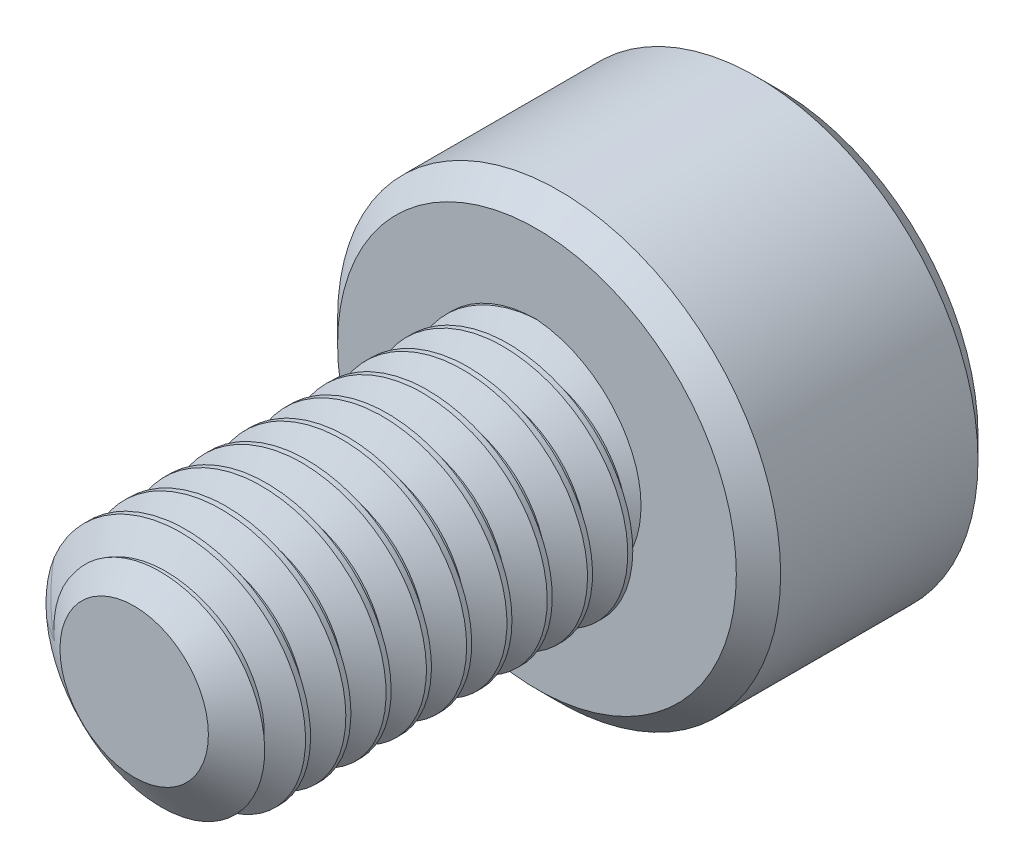
from build123d import *

# Parameters (mm, degrees)
SKETCH1_R          = 1.5
EXTRUDE1_DEPTH     = 5
CUT_SWEEP1_PITCH   = 0.5
SKETCH6_R          = 2.75
EXTRUDE2_DEPTH     = 3
CUT_EXTRUDE1_DEPTH = 1.875
CHAMFER1_SIZE      = 0.275


with BuildPart() as part:
    # Sketch1 → Extrude1 (new body)
    with BuildSketch(Plane.XY):
        Circle(SKETCH1_R)
    extrude(amount=-EXTRUDE1_DEPTH)

    # Cut-Sweep1: the profile of Sketch3 profile screwed along a right-hand helix of 11 turns, 6 arcs to a turn; built about Z, then put on its axis
    cut_sweep1_z = Axis((0, 0, 0), (0, 0, 1))
    cut_sweep1_corners = [(1.5003, 0, -0.437673205), (1.175240474, 0, -0.25), (1.175240474, 0, -0.1875), (1.5003, 0, 0.000173205)]
    with BuildLine(mode=Mode.PRIVATE) as cut_sweep1_profile:
        Line(cut_sweep1_corners[0], cut_sweep1_corners[1])
        Line(cut_sweep1_corners[1], cut_sweep1_corners[2])
        Line(cut_sweep1_corners[2], cut_sweep1_corners[3])
        Line(cut_sweep1_corners[3], cut_sweep1_corners[0])
    cut_sweep1_cap = Face(cut_sweep1_profile.wire())
    cut_sweep1_turn_angles = [0, 30, 60, 90, 120, 150, 180, 210, 240, 270, 300, 330, 360]
    cut_sweep1_turn_weights = [1, 0.8660254037844387, 1, 0.8660254037844387, 1, 0.8660254037844387, 1, 0.8660254037844387, 1, 0.8660254037844387, 1, 0.8660254037844387, 1]
    cut_sweep1_turn_rails = [Edge.make_bspline([Vector(p[0], p[1], 0).rotate(cut_sweep1_z, cut_sweep1_turn_angles[k]) / cut_sweep1_turn_weights[k] + Vector(0, 0, p[2] + CUT_SWEEP1_PITCH * cut_sweep1_turn_angles[k] / 360) for k in range(13)], [0, 0, 0, 1, 1, 2, 2, 3, 3, 4, 4, 5, 5, 6, 6, 6], 2, cut_sweep1_turn_weights) for p in cut_sweep1_corners]
    cut_sweep1_turn_sides = [Face.make_surface_from_curves(cut_sweep1_turn_rails[p[0]], cut_sweep1_turn_rails[p[1]]) for p in [(0, 1), (1, 2), (2, 3), (3, 0)]]
    cut_sweep1 = Plane(origin=(0, 0, 0), x_dir=(0, 1, 0), z_dir=(0, 0, -1)) * Solid(Shell([*[p.moved(Location((0, 0, CUT_SWEEP1_PITCH * i))) for i in range(11) for p in cut_sweep1_turn_sides], cut_sweep1_cap, cut_sweep1_cap.rotate(cut_sweep1_z, 3960).moved(Location((0, 0, CUT_SWEEP1_PITCH * 3960 / 360)))]))
    add(cut_sweep1, mode=Mode.SUBTRACT)

    # Sketch4 → Cut-Revolve1 (revolve, cut)
    with BuildSketch(Plane(origin=(0, 0, 0), x_dir=(0, 0, -1), z_dir=(1, 0, 0)), mode=Mode.PRIVATE) as cut_revolve1_sk:
        Polygon((0.405251783, 1.5), (0, 0.921240474), (0, 1.5), align=None)
    revolve(cut_revolve1_sk.sketch.rotate(Axis((0, 0, 0), (0, 0, -1)), 263.352109169), axis=Axis((0, 0, 0), (0, 0, -1)), mode=Mode.SUBTRACT)

    # Sketch6 → Extrude2 (add)
    with BuildSketch(Plane(origin=(0, 0, -5), x_dir=(-1, 0, 0), z_dir=(0, 0, -1))):
        Circle(SKETCH6_R)
    extrude(amount=EXTRUDE2_DEPTH)

    # Sketch7 → Cut-Extrude1 (cut)
    with BuildSketch(Plane(origin=(0, 0, -8), x_dir=(-1, 0, 0), z_dir=(0, 0, -1))):
        Polygon((0, 1.443375673), (-1.25, 0.721687836), (-1.25, -0.721687836), (0, -1.443375673), (1.25, -0.721687836), (1.25, 0.721687836), align=None)
    extrude(amount=-CUT_EXTRUDE1_DEPTH, mode=Mode.SUBTRACT)

    # Cut-Extrude2 cone 1 section (through the dimple's axis) → Cut-Extrude2 (revolve, cut)
    with BuildSketch(Plane(origin=(0, 0, -8), x_dir=(0, 1, 0), z_dir=(1, 0, 0))):
        Polygon((0, 0), (1.443375673, 0), (0, 1.443375673), align=None)
    revolve(axis=Axis((0, 0, -8), (0, 0, 1)), mode=Mode.SUBTRACT)

    # Chamfer1
    chamfer1_edges = [part.edges().sort_by_distance(p)[0] for p in [
        (2.75, 0, -5),
        (2.75, 0, -8),
    ]]
    chamfer(chamfer1_edges, length=CHAMFER1_SIZE)


solid = part.part
